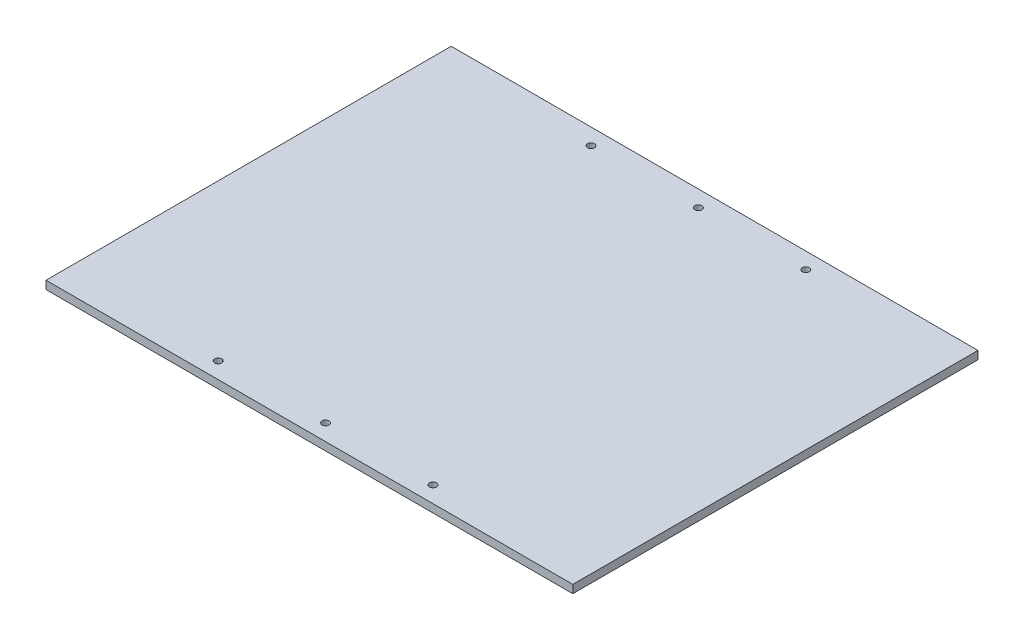
from build123d import *

# Parameters (mm, degrees)
SKIZZE1_W                       = 260
SKIZZE1_H                       = 200
SKIZZE1_R                       = 1.75
AUFSATZ_LINEAR_AUSTRAGEN1_DEPTH = 4


with BuildPart() as part:
    # Skizze1 → Aufsatz-Linear austragen1 (new body)
    with BuildSketch(Plane(origin=(0, 0, 0), x_dir=(1, 0, 0), z_dir=(0, 1, 0))):
        Rectangle(SKIZZE1_W, SKIZZE1_H)
        with Locations((-53, -92)):
            Circle(SKIZZE1_R, mode=Mode.SUBTRACT)
        with Locations((53, -92)):
            Circle(SKIZZE1_R, mode=Mode.SUBTRACT)
        with Locations((0, -92)):
            Circle(SKIZZE1_R, mode=Mode.SUBTRACT)
        with Locations((0, 92)):
            Circle(SKIZZE1_R, mode=Mode.SUBTRACT)
        with Locations((53, 92)):
            Circle(SKIZZE1_R, mode=Mode.SUBTRACT)
        with Locations((-53, 92)):
            Circle(SKIZZE1_R, mode=Mode.SUBTRACT)
    extrude(amount=AUFSATZ_LINEAR_AUSTRAGEN1_DEPTH)


solid = part.part
